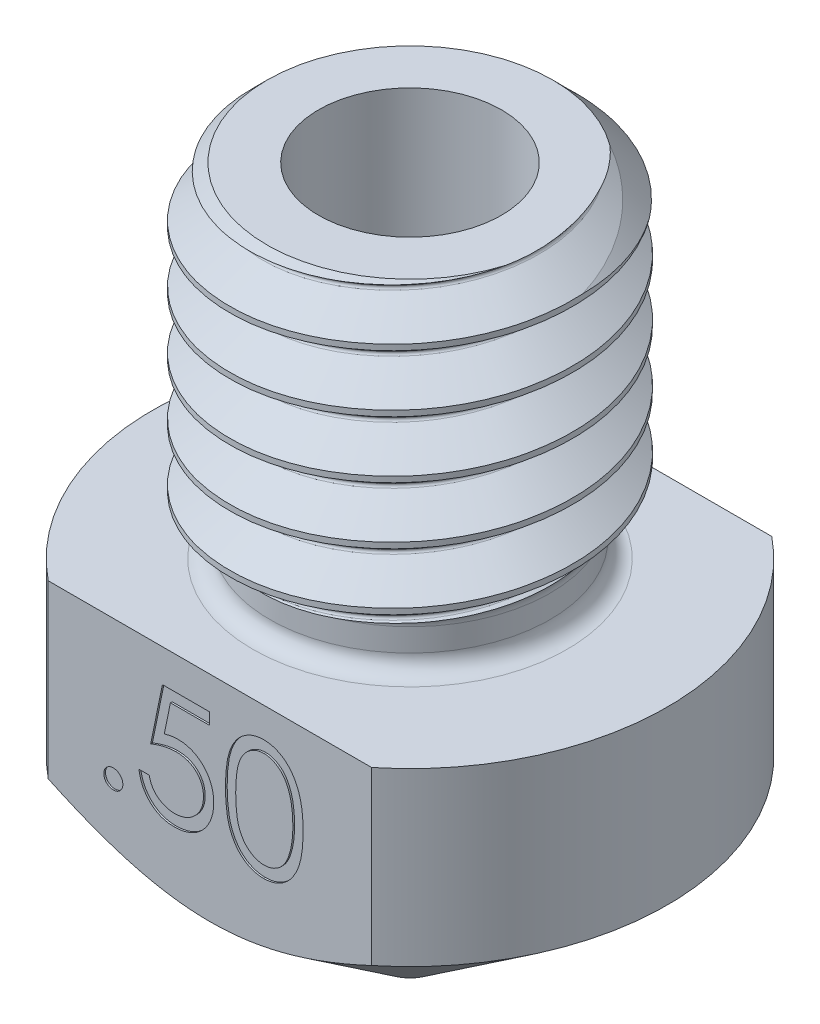
from build123d import *

# Parameters (mm, degrees)
SKETCH2_OUTSIDE_W   = 14.498
SKETCH2_OUTSIDE_H   = 14.498
SKETCH2_OUTSIDE_W_2 = 13.807754442
SKETCH2_OUTSIDE_H_2 = 7
CUT_EXTRUDE1_DEPTH  = 9.746427842
CUT_SWEEP1_PITCH    = 1
CUT_EXTRUDE2_DEPTH  = 0.03


with BuildPart() as part:
    # Sketch1 → Revolve1 (revolve)
    with BuildSketch(Plane.XY, mode=Mode.PRIVATE) as revolve1_sk:
        with BuildLine():
            Line((0.25, 0), (0.25, 1.5))
            Line((0.25, 1.5), (1.6, 3.10886735))
            Line((1.6, 3.10886735), (1.6, 12))
            Line((1.6, 12), (2.5, 12))
            Line((2.5, 12), (3, 11.5))
            Line((3, 11.5), (3, 7))
            Line((3, 7), (2.75, 7))
            ThreePointArc((2.75, 7), (2.537867966, 6.912132034), (2.45, 6.7))
            Line((2.45, 6.7), (2.45, 6.3))
            ThreePointArc((2.45, 6.3), (2.537867966, 6.087867966), (2.75, 6))
            Line((2.75, 6), (4.5, 6))
            Line((4.5, 6), (4.5, 3))
            Line((4.5, 3), (0.5, 0))
            Line((0.5, 0), (0.25, 0))
        make_face()
    revolve(revolve1_sk.sketch.rotate(Axis((0, 0, 0), (0, 1, 0)), 90), axis=Axis((0, 0, 0), (0, 1, 0)))

    # Sketch2 outside → Cut-Extrude1 (cut, through all)
    with BuildSketch(Plane(origin=(0, 6, 0), x_dir=(1, 0, 0), z_dir=(0, 1, 0))):
        Rectangle(SKETCH2_OUTSIDE_W, SKETCH2_OUTSIDE_H)
        Rectangle(SKETCH2_OUTSIDE_W_2, SKETCH2_OUTSIDE_H_2, mode=Mode.SUBTRACT)
    extrude(amount=-CUT_EXTRUDE1_DEPTH, mode=Mode.SUBTRACT)

    # Cut-Sweep1: the profile of Sketch5 screwed along a right-hand helix of 7 turns, 8 arcs to a turn; built about Z, then put on its axis
    cut_sweep1_z = Axis((0, 0, 0), (0, 0, 1))
    cut_sweep1_corners = [(3, 0.047679434, -0.898736152), (2.421139351, 0.026002757, -0.490140422), (2.4, 0.023839717, -0.449368076), (2.421139351, 0.021676677, -0.40859573), (3, 0, 0)]
    with BuildLine(mode=Mode.PRIVATE) as cut_sweep1_profile:
        Line(cut_sweep1_corners[0], cut_sweep1_corners[1])
        Line(cut_sweep1_corners[3], cut_sweep1_corners[4])
        Line(cut_sweep1_corners[4], cut_sweep1_corners[0])
        ThreePointArc((2.421139351, 0.026002757, -0.490140422), (2.405598241, 0.025057597, -0.472324569), (2.4, 0.023839717, -0.449368076))
        ThreePointArc((2.4, 0.023839717, -0.449368076), (2.405598241, 0.022621837, -0.426411584), (2.421139351, 0.021676677, -0.40859573))
    cut_sweep1_cap = Face(cut_sweep1_profile.wire())
    cut_sweep1_arcs = [((2.421139351, 0.026002757, -0.490140422), (2.4, 0.025211149, -0.475218958), (2.4, 0.023839717, -0.449368076), (1, 0.8880351850424159, 1)), ((2.4, 0.023839717, -0.449368076), (2.4, 0.022468285, -0.423517195), (2.421139351, 0.021676677, -0.40859573), (1, 0.8880351850424159, 1))]  # start, shoulder, end, weights
    cut_sweep1_turn_angles = [0, 22.5, 45, 67.5, 90, 112.5, 135, 157.5, 180, 202.5, 225, 247.5, 270, 292.5, 315, 337.5, 360]
    cut_sweep1_turn_weights = [1, 0.9238795325112867, 1, 0.9238795325112867, 1, 0.9238795325112867, 1, 0.9238795325112867, 1, 0.9238795325112867, 1, 0.9238795325112867, 1, 0.9238795325112867, 1, 0.9238795325112867, 1]
    cut_sweep1_turn_rails = [Edge.make_bspline([Vector(p[0], p[1], 0).rotate(cut_sweep1_z, cut_sweep1_turn_angles[k]) / cut_sweep1_turn_weights[k] + Vector(0, 0, p[2] + CUT_SWEEP1_PITCH * cut_sweep1_turn_angles[k] / 360) for k in range(17)], [0, 0, 0, 1, 1, 2, 2, 3, 3, 4, 4, 5, 5, 6, 6, 7, 7, 8, 8, 8], 2, cut_sweep1_turn_weights) for p in cut_sweep1_corners]
    cut_sweep1_turn_sides = [*[Face.make_surface_from_curves(cut_sweep1_turn_rails[p[0]], cut_sweep1_turn_rails[p[1]]) for p in [(0, 1), (3, 4), (4, 0)]], *[Face.make_bezier_surface([[Vector(p[j][0], p[j][1], 0).rotate(cut_sweep1_z, cut_sweep1_turn_angles[2 * i + k]) / cut_sweep1_turn_weights[2 * i + k] + Vector(0, 0, p[j][2] + CUT_SWEEP1_PITCH * cut_sweep1_turn_angles[2 * i + k] / 360) for k in range(3)] for j in range(3)], [[p[3][j] * cut_sweep1_turn_weights[2 * i + k] for k in range(3)] for j in range(3)]) for p in cut_sweep1_arcs for i in range(8)]]
    cut_sweep1 = Plane(origin=(0, 6.9, 0), x_dir=(-1, 0, 0), z_dir=(0, 1, 0)) * Solid(Shell([*[p.moved(Location((0, 0, CUT_SWEEP1_PITCH * i))) for i in range(7) for p in cut_sweep1_turn_sides], cut_sweep1_cap, cut_sweep1_cap.rotate(cut_sweep1_z, 2520).moved(Location((0, 0, CUT_SWEEP1_PITCH * 2520 / 360)))]))
    add(cut_sweep1, mode=Mode.SUBTRACT)

    # Sketch6 → Cut-Extrude2 (cut)
    # profile 1 of 3: a face of its own
    with BuildSketch(Plane.XY.offset(3.5)):
        with BuildLine():
            add(Edge.make_bspline(
                [(-1.689897685, 3.733505223), (-1.678760421, 3.732843413), (-1.656927116, 3.731546013), (-1.6253619, 3.722645056), (-1.596793523, 3.706840107), (-1.571346526, 3.685775663), (-1.550371397, 3.660235284), (-1.534003196, 3.631894765), (-1.525179775, 3.600065283), (-1.523891826, 3.578105469), (-1.523231018, 3.566838556)],
                knots=[0, 0, 0, 0, 1.020151414, 1.999887582, 2.974338812, 3.990962822, 5.007586832, 5.987933904, 6.967670073, 8, 8, 8, 8], degree=3))
            add(Edge.make_bspline(
                [(-1.523231018, 3.566838556), (-1.523914218, 3.555842367), (-1.52526148, 3.534158045), (-1.53398297, 3.502568638), (-1.550496142, 3.474210407), (-1.571201852, 3.448323471), (-1.596799814, 3.427214402), (-1.62542944, 3.411543919), (-1.656853017, 3.402005645), (-1.678748058, 3.400790618), (-1.689897685, 3.400171889)],
                knots=[0, 0, 0, 0, 1.009421747, 1.99056486, 2.972319754, 3.999869655, 5.017953583, 5.993804169, 6.978383603, 8, 8, 8, 8], degree=3))
            add(Edge.make_bspline(
                [(-1.689897685, 3.400171889), (-1.701055345, 3.40076823), (-1.722838021, 3.401932445), (-1.754144303, 3.411739763), (-1.782948285, 3.427067454), (-1.808541263, 3.448362831), (-1.82942039, 3.474077199), (-1.845206323, 3.50276394), (-1.854686408, 3.534067618), (-1.855933193, 3.555824557), (-1.856564351, 3.566838556)],
                knots=[0, 0, 0, 0, 1.022052826, 1.995314843, 2.982371812, 4.00089066, 5.028879526, 6.005146991, 6.990147033, 8, 8, 8, 8], degree=3))
            add(Edge.make_bspline(
                [(-1.856564351, 3.566838556), (-1.855957438, 3.578123916), (-1.854772513, 3.600157196), (-1.845186421, 3.631699543), (-1.829542871, 3.660367222), (-1.808396931, 3.685736697), (-1.782954477, 3.706986584), (-1.754213788, 3.72245218), (-1.722762622, 3.73161813), (-1.701042657, 3.732865282), (-1.689897685, 3.733505223)],
                knots=[0, 0, 0, 0, 1.032775665, 2.016367738, 2.991239715, 4.008302682, 5.025365648, 6.011011707, 6.979408107, 8, 8, 8, 8], degree=3))
        make_face()
    # profile 2 of 3: a face of its own
    with BuildSketch(Plane.XY.offset(3.5)):
        with BuildLine():
            Line((-0.010410505, 5.425812915), (-0.010410505, 5.22068471))
            Line((-0.010410505, 5.22068471), (-0.690698967, 5.22068471))
            Line((-0.690698967, 5.22068471), (-0.798471403, 4.694643043))
            add(Edge.make_bspline(
                [(-0.798471403, 4.694643043), (-0.777296617, 4.700488913), (-0.73627382, 4.71181436), (-0.675725328, 4.724389086), (-0.618244069, 4.73196934), (-0.580943857, 4.733004375), (-0.56289448, 4.733505223)],
                knots=[0, 0, 0, 0, 1.100273476, 2.13160584, 3.095893838, 4, 4, 4, 4], degree=3))
            add(Edge.make_bspline(
                [(-0.56289448, 4.733505223), (-0.540560914, 4.733021831), (-0.496647544, 4.732071362), (-0.432396717, 4.72294459), (-0.371063635, 4.708578925), (-0.312776567, 4.688510055), (-0.257427681, 4.662847351), (-0.205526217, 4.630790242), (-0.156293124, 4.593342624), (-0.110611642, 4.550288332), (-0.06916918, 4.502904551), (-0.032731471, 4.451957196), (-0.00178142, 4.397941389), (0.02311044, 4.340341041), (0.042987203, 4.279792953), (0.056216914, 4.215660049), (0.065026462, 4.148546838), (0.066010683, 4.102658512), (0.066512572, 4.079258428)],
                knots=[0, 0, 0, 0, 1.052922333, 2.070308379, 3.05430497, 4.020497103, 4.973039431, 5.925935799, 6.892292201, 7.88610001, 8.88166317, 9.857072816, 10.836096531, 11.812156883, 12.81219415, 13.836441305, 14.89672472, 16, 16, 16, 16], degree=3))
            add(Edge.make_bspline(
                [(0.066512572, 4.079258428), (0.066132529, 4.062960016), (0.065377579, 4.030583452), (0.061538386, 3.982501051), (0.054146548, 3.935436575), (0.044222134, 3.88938378), (0.031340752, 3.844429853), (0.015747007, 3.800446123), (-0.003336437, 3.757706347), (-0.024268651, 3.715806122), (-0.047838067, 3.675692689), (-0.073997214, 3.638178982), (-0.101634638, 3.60270225), (-0.131372573, 3.569642974), (-0.163487427, 3.539218392), (-0.197590265, 3.511247946), (-0.233408962, 3.485258614), (-0.271497672, 3.46230536), (-0.311007662, 3.441183671), (-0.3525095, 3.423855935), (-0.395058472, 3.408364205), (-0.439266972, 3.396015903), (-0.485034865, 3.386340158), (-0.532437594, 3.379768386), (-0.581226548, 3.37498185), (-0.614297984, 3.374682218), (-0.631003454, 3.374530864)],
                knots=[0, 0, 0, 0, 1.056347294, 2.098418968, 3.122841568, 4.141288669, 5.149314143, 6.15115421, 7.162517403, 8.180376062, 9.185164535, 10.17417709, 11.141909838, 12.097768115, 13.052685741, 14.0056014, 14.954263652, 15.917497458, 16.885230207, 17.854509472, 18.828990115, 19.81800267, 20.826176721, 21.857883937, 22.917946725, 24, 24, 24, 24], degree=3))
            add(Edge.make_bspline(
                [(-0.631003454, 3.374530864), (-0.650931557, 3.374925628), (-0.690137746, 3.375702281), (-0.74757807, 3.383827129), (-0.802843559, 3.395463653), (-0.855489331, 3.412970093), (-0.905987196, 3.43490569), (-0.953657321, 3.462629217), (-0.999717764, 3.494045847), (-1.042296071, 3.531120335), (-1.08181385, 3.571643582), (-1.117188998, 3.615619377), (-1.148693899, 3.662321915), (-1.17582404, 3.711978003), (-1.198965767, 3.764457163), (-1.21714576, 3.819956021), (-1.231819106, 3.878184595), (-1.238026774, 3.918272315), (-1.241179736, 3.938633428)],
                knots=[0, 0, 0, 0, 1.0467383, 2.05933395, 3.04377827, 4.011590433, 4.970194871, 5.932262533, 6.905835911, 7.896367577, 8.894135286, 9.877477877, 10.858688626, 11.851381753, 12.8477658, 13.868841284, 14.917554742, 16, 16, 16, 16], degree=3))
            Line((-1.241179736, 3.938633428), (-1.061692557, 3.938633428))
            add(Edge.make_bspline(
                [(-1.061692557, 3.938633428), (-1.057276238, 3.919561169), (-1.048787829, 3.882903229), (-1.030155972, 3.831399606), (-1.007375472, 3.785502906), (-0.980287273, 3.744606002), (-0.94797297, 3.708943717), (-0.91109901, 3.677162539), (-0.869757454, 3.648491037), (-0.823818466, 3.624592313), (-0.775353849, 3.604210168), (-0.724629729, 3.590637771), (-0.673027245, 3.581094403), (-0.63812532, 3.580139111), (-0.620586787, 3.579659069)],
                knots=[0, 0, 0, 0, 1.136247022, 2.183929868, 3.172523383, 4.106158343, 5.02341133, 5.958108904, 6.928429099, 7.938127109, 8.96079061, 9.975095812, 10.982467395, 12, 12, 12, 12], degree=3))
            add(Edge.make_bspline(
                [(-0.620586787, 3.579659069), (-0.603467676, 3.580128085), (-0.569760006, 3.581051581), (-0.5201535, 3.588159588), (-0.472260429, 3.599106771), (-0.426553368, 3.615489546), (-0.382232488, 3.635400813), (-0.340418905, 3.660952285), (-0.299902975, 3.69035801), (-0.261944042, 3.724047513), (-0.227178642, 3.761173053), (-0.196460859, 3.80087442), (-0.170874051, 3.843226904), (-0.149311703, 3.887497277), (-0.132938389, 3.934170738), (-0.121257829, 3.983028553), (-0.114398938, 4.034191399), (-0.113455406, 4.069088147), (-0.112974608, 4.086870607)],
                knots=[0, 0, 0, 0, 1.027316725, 2.022795036, 3.002884548, 3.971462791, 4.93288096, 5.914575861, 6.907176829, 7.935150275, 8.956128384, 9.956726525, 10.942570165, 11.921478529, 12.907843606, 13.90538589, 14.932640048, 16, 16, 16, 16], degree=3))
            add(Edge.make_bspline(
                [(-0.112974608, 4.086870607), (-0.113350882, 4.102913894), (-0.114087385, 4.134316345), (-0.120104853, 4.180258748), (-0.130571695, 4.223729058), (-0.145099626, 4.264937192), (-0.163545059, 4.303922016), (-0.186085809, 4.340723765), (-0.213144893, 4.374857384), (-0.244054544, 4.406338843), (-0.277916282, 4.435393057), (-0.315312706, 4.460161107), (-0.355461236, 4.480997631), (-0.39787815, 4.498979344), (-0.443572377, 4.511894056), (-0.491639025, 4.521589991), (-0.542597143, 4.527198769), (-0.577437537, 4.527976991), (-0.595346403, 4.528377017)],
                knots=[0, 0, 0, 0, 1.045622112, 2.046656509, 3.013763289, 3.955457236, 4.890082067, 5.820317437, 6.762574623, 7.722996705, 8.69280354, 9.665887285, 10.63943826, 11.638615906, 12.663482002, 13.728887084, 14.832589034, 16, 16, 16, 16], degree=3))
            add(Edge.make_bspline(
                [(-0.595346403, 4.528377017), (-0.610848648, 4.528045251), (-0.642856851, 4.527360238), (-0.691955609, 4.522316525), (-0.743550879, 4.514179785), (-0.797444877, 4.502987644), (-0.853799453, 4.488341314), (-0.912495682, 4.470790171), (-0.973656977, 4.449806172), (-1.014867105, 4.433959193), (-1.036051531, 4.425812915)],
                knots=[0, 0, 0, 0, 0.817624296, 1.688186739, 2.600797293, 3.572016777, 4.590301741, 5.671205678, 6.80286297, 8, 8, 8, 8], degree=3))
            Line((-1.036051531, 4.425812915), (-0.830923326, 5.425812915))
            Line((-0.830923326, 5.425812915), (-0.010410505, 5.425812915))
        make_face()
    # profile 3 of 3: a face of its own
    with BuildSketch(Plane.XY.offset(3.5)):
        with BuildLine():
            add(Edge.make_bspline(
                [(0.271640777, 4.425011633), (0.271828216, 4.457067283), (0.272192319, 4.519335845), (0.276242845, 4.610069927), (0.282971612, 4.695190092), (0.292192968, 4.774700415), (0.303414671, 4.848621423), (0.318394949, 4.91675557), (0.335430836, 4.979418203), (0.355175091, 5.036813659), (0.377453827, 5.089715204), (0.401701976, 5.139101033), (0.428881859, 5.184896423), (0.457440095, 5.227832303), (0.488532707, 5.267205843), (0.521274873, 5.303573079), (0.556944517, 5.336093507), (0.594329093, 5.365719966), (0.633767073, 5.391691093), (0.67413431, 5.414566943), (0.715708657, 5.434109725), (0.758603618, 5.449475688), (0.802433651, 5.4621676), (0.847351975, 5.470846999), (0.893432755, 5.47630809), (0.924536432, 5.476830185), (0.940310649, 5.477094966)],
                knots=[0, 0, 0, 0, 1.646270934, 3.197905019, 4.663502075, 6.030701355, 7.308322542, 8.50163776, 9.611534131, 10.641858119, 11.616356847, 12.558055219, 13.465016945, 14.349605745, 15.204443733, 16.039544428, 16.859896111, 17.680448484, 18.487036065, 19.28249412, 20.06191084, 20.843045899, 21.620316918, 22.403196591, 23.190181807, 24, 24, 24, 24], degree=3))
            add(Edge.make_bspline(
                [(0.940310649, 5.477094966), (0.956216636, 5.476816215), (0.987848641, 5.476261866), (1.03461457, 5.470933898), (1.080300103, 5.462093257), (1.124710467, 5.449566985), (1.16821046, 5.434026599), (1.210459836, 5.414548246), (1.251721025, 5.391874608), (1.291338332, 5.365232392), (1.329746684, 5.335528234), (1.366002663, 5.301949566), (1.400109569, 5.264835441), (1.432495458, 5.224582947), (1.462241513, 5.180420042), (1.490569189, 5.133114836), (1.515924638, 5.081840056), (1.540344452, 5.027451217), (1.56142273, 4.968443412), (1.580432013, 4.905149264), (1.595791424, 4.836821157), (1.608585294, 4.763817588), (1.618496663, 4.685870455), (1.625715316, 4.603146846), (1.629528507, 4.515592337), (1.630246622, 4.455730709), (1.630615136, 4.425011633)],
                knots=[0, 0, 0, 0, 0.810914788, 1.612654377, 2.396697861, 3.181598691, 3.963628158, 4.749916497, 5.551656086, 6.361998678, 7.18212741, 8.025565596, 8.878627764, 9.750805457, 10.657531673, 11.591944965, 12.560506719, 13.57287815, 14.630710178, 15.753379473, 16.941251878, 18.199788006, 19.531962791, 20.947069417, 22.433333509, 24, 24, 24, 24], degree=3))
            add(Edge.make_bspline(
                [(1.630615136, 4.425011633), (1.630242802, 4.394426543), (1.629517324, 4.334832741), (1.625758063, 4.247672184), (1.618353131, 4.165387588), (1.609090281, 4.087781609), (1.596261159, 4.015177256), (1.580486778, 3.947323285), (1.562972308, 3.883926673), (1.541352426, 3.825506781), (1.517689163, 3.771248653), (1.491943336, 3.720581711), (1.464360578, 3.673058115), (1.434309867, 3.62905826), (1.402279345, 3.588270456), (1.367583466, 3.551414672), (1.331200274, 3.517602859), (1.292678894, 3.487516215), (1.252443722, 3.461182041), (1.211324249, 3.437631269), (1.168590887, 3.418641158), (1.125212057, 3.40233542), (1.080567276, 3.389878019), (1.034712196, 3.381264387), (0.987880061, 3.375223331), (0.956222024, 3.374762485), (0.940310649, 3.374530864)],
                knots=[0, 0, 0, 0, 1.561518951, 3.042555995, 4.452378317, 5.7783523, 7.031515105, 8.214008947, 9.334062868, 10.386615937, 11.391082383, 12.354592575, 13.286541444, 14.194233754, 15.072674879, 15.931287219, 16.775624067, 17.606195743, 18.42308326, 19.229000347, 20.022332153, 20.807536673, 21.593273796, 22.3848459, 23.188221202, 24, 24, 24, 24], degree=3))
            add(Edge.make_bspline(
                [(0.940310649, 3.374530864), (0.924536869, 3.374797352), (0.893434055, 3.375322816), (0.847346955, 3.380759234), (0.80261413, 3.389499522), (0.759014842, 3.401737581), (0.716325405, 3.416717488), (0.675127527, 3.436233878), (0.634963136, 3.458710489), (0.59593939, 3.484307873), (0.558789583, 3.513634549), (0.523304666, 3.546071285), (0.490376084, 3.58242752), (0.459728029, 3.622129191), (0.430599979, 3.664811044), (0.403806051, 3.711055828), (0.379022706, 3.760680177), (0.356369283, 3.814004697), (0.336284332, 3.871807513), (0.318542785, 3.934749901), (0.304534695, 4.003387407), (0.292544434, 4.07716876), (0.282873358, 4.156411006), (0.276270887, 4.241157165), (0.272190135, 4.331354427), (0.271827238, 4.39322287), (0.271640777, 4.425011633)],
                knots=[0, 0, 0, 0, 0.810891512, 1.598919785, 2.382837074, 3.152667961, 3.926044502, 4.706494248, 5.493654104, 6.291793342, 7.103789334, 7.925228297, 8.761435821, 9.622817696, 10.50288917, 11.416980706, 12.369136599, 13.353924996, 14.394355917, 15.514179734, 16.714354668, 17.994756427, 19.357759367, 20.818452758, 22.365282078, 24, 24, 24, 24], degree=3))
        make_face()
        with BuildLine():
            add(Edge.make_bspline(
                [(0.451127956, 4.425812915), (0.451196212, 4.399099373), (0.451328682, 4.347253633), (0.454789368, 4.271914627), (0.459503787, 4.201645867), (0.465584528, 4.136358132), (0.474614784, 4.076272411), (0.484732949, 4.020975449), (0.497046143, 3.970759885), (0.511614724, 3.925281136), (0.528208494, 3.883767382), (0.54632613, 3.845138117), (0.565789401, 3.80893701), (0.587571772, 3.775489234), (0.611294666, 3.744685712), (0.636422242, 3.715981236), (0.66389229, 3.690382961), (0.701894429, 3.659681901), (0.752063843, 3.627956682), (0.815275532, 3.600330345), (0.880228932, 3.582968941), (0.924315361, 3.58076108), (0.946320264, 3.579659069)],
                knots=[0, 0, 0, 0, 1.459021318, 2.831673884, 4.118529203, 5.306027144, 6.411944654, 7.436330062, 8.375795394, 9.233974572, 10.042671642, 10.816086306, 11.563610507, 12.285937304, 12.993564865, 13.685989202, 14.367179055, 15.041617293, 16.353048772, 17.594441528, 18.799311195, 20, 20, 20, 20], degree=3))
            add(Edge.make_bspline(
                [(0.946320264, 3.579659069), (0.968467505, 3.580572086), (1.012716261, 3.582396236), (1.077364144, 3.599995515), (1.140124298, 3.626549538), (1.189308264, 3.657948112), (1.22672686, 3.687850015), (1.253536569, 3.713344099), (1.278143454, 3.741890309), (1.301481782, 3.772689907), (1.322886969, 3.806331326), (1.342351619, 3.842652798), (1.360113532, 3.881755185), (1.370232986, 3.909052179), (1.375406802, 3.923008428)],
                knots=[0, 0, 0, 0, 1.353760809, 2.704726607, 4.075137775, 5.516104923, 6.260822281, 7.007110065, 7.778089737, 8.566572457, 9.372053459, 10.217411131, 11.088608312, 12, 12, 12, 12], degree=3))
            add(Edge.make_bspline(
                [(1.375406802, 3.923008428), (1.381436384, 3.940853993), (1.393679021, 3.977088144), (1.409457177, 4.033295945), (1.42188312, 4.092268953), (1.433062186, 4.153654734), (1.440692503, 4.217905992), (1.446834111, 4.284823926), (1.450451646, 4.35445899), (1.450900076, 4.401770413), (1.451127956, 4.425812915)],
                knots=[0, 0, 0, 0, 0.884706709, 1.796334032, 2.740027952, 3.714592787, 4.726048262, 5.777819803, 6.87074269, 8, 8, 8, 8], degree=3))
            add(Edge.make_bspline(
                [(1.451127956, 4.425812915), (1.450813562, 4.449851528), (1.450198541, 4.496876193), (1.447847691, 4.565743725), (1.441777077, 4.631153874), (1.435034723, 4.69338843), (1.425093454, 4.752102889), (1.414374707, 4.807788777), (1.399974014, 4.85975622), (1.384591286, 4.908818838), (1.366985346, 4.954419212), (1.347604926, 4.996769947), (1.326906778, 5.036075504), (1.304425498, 5.072228042), (1.280427965, 5.105389495), (1.254280794, 5.134894978), (1.227021152, 5.16165896), (1.188839903, 5.192208999), (1.138854595, 5.22335854), (1.076657082, 5.252024688), (1.011930999, 5.26848657), (0.96817474, 5.270807534), (0.946320264, 5.271966761)],
                knots=[0, 0, 0, 0, 1.31362396, 2.569729283, 3.763502607, 4.902122613, 5.988968491, 7.01645872, 7.998833611, 8.933434873, 9.825090667, 10.667526885, 11.477055099, 12.250526234, 12.991942729, 13.710640831, 14.402115721, 15.076753259, 16.378508321, 17.609869233, 18.806226677, 20, 20, 20, 20], degree=3))
            add(Edge.make_bspline(
                [(0.946320264, 5.271966761), (0.924199926, 5.270805934), (0.879918951, 5.268482166), (0.81452012, 5.252086021), (0.751831919, 5.223507184), (0.70197879, 5.192105828), (0.663770912, 5.162198221), (0.636866516, 5.136263105), (0.611640132, 5.107893817), (0.588401446, 5.076807008), (0.566636142, 5.043398227), (0.546646992, 5.007404647), (0.528637089, 4.968643867), (0.512017354, 4.927148761), (0.497404332, 4.881673936), (0.485350639, 4.831520225), (0.47421518, 4.776399144), (0.466332169, 4.715987997), (0.459324309, 4.650683909), (0.454820681, 4.580239728), (0.451317106, 4.504774367), (0.451192269, 4.452660562), (0.451127956, 4.425812915)],
                knots=[0, 0, 0, 0, 1.207732386, 2.417664972, 3.655092373, 4.956220595, 5.625982001, 6.301752483, 6.994047911, 7.697131622, 8.419323945, 9.170223765, 9.943494443, 10.752040957, 11.610060368, 12.549350801, 13.567764191, 14.679664412, 15.874934091, 17.154273443, 18.533957287, 20, 20, 20, 20], degree=3))
        make_face(mode=Mode.SUBTRACT)
    extrude(amount=-CUT_EXTRUDE2_DEPTH, mode=Mode.SUBTRACT)


solid = part.part
